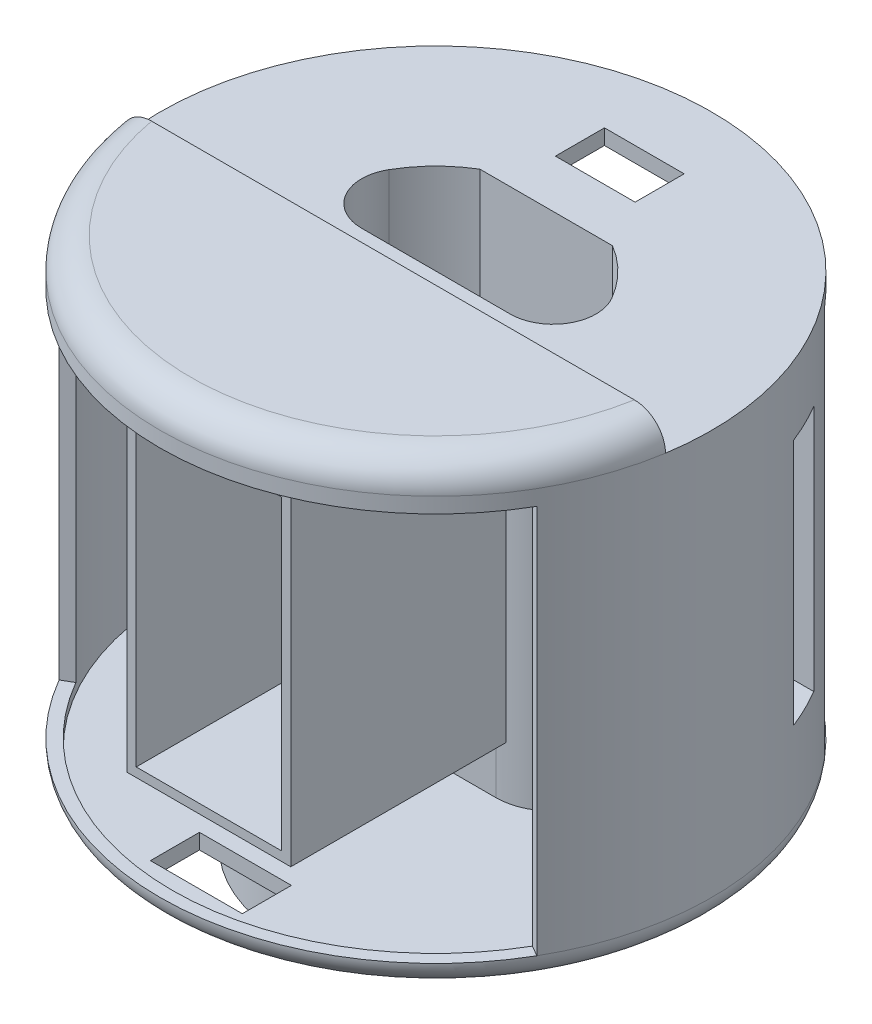
from build123d import *
from build123d.topology import SkipClean

# Parameters (mm, degrees)
CUT_EXTRUDE1_DEPTH           = 5
CUT_EXTRUDE3_DEPTH           = 70
SKETCH8_R                    = 43
CUT_EXTRUDE4_DEPTH           = 65
FILLET1_R                    = 7
SKETCH12_W                   = 6.5
SKETCH12_H                   = 63.5
CUT_REVOLVE1_ANGLE           = 60
CUT_REVOLVE1_OTHER_WAY_ANGLE = 60
SKETCH18_W                   = 13
SKETCH18_H                   = 8
CUT_EXTRUDE13_DEPTH          = 5
SKETCH20_W                   = 100
SKETCH20_H                   = 7
CUT_EXTRUDE15_DEPTH          = 5
SKETCH19_R                   = 1.5
CUT_EXTRUDE14_DEPTH          = 12
FILLET3_R                    = 4
SKETCH24_W                   = 2
SKETCH24_H                   = 3
BOSS_EXTRUDE3_DEPTH          = 2
CIRPATTERN2_COUNT            = 5
SKETCH26_W                   = 5
SKETCH26_H                   = 63.5
CUT_REVOLVE2_ANGLE           = 50
CUT_REVOLVE2_OTHER_WAY_ANGLE = 50
FILLET8_R                    = 9
SKETCH50_W                   = 13
SKETCH50_H                   = 5
CUT_EXTRUDE23_DEPTH          = 7
WRAP1_SECTION_W              = 14
WRAP1_SECTION_H              = 8
WRAP1_ANGLE                  = 29.893450181
SKETCH52_W                   = 21.079035893
SKETCH52_H                   = 8
BOSS_EXTRUDE11_DEPTH         = 7
BOSS_EXTRUDE12_START         = -1
SKETCH53_W                   = 3
SKETCH53_H                   = 7
BOSS_EXTRUDE12_DEPTH         = 3
SKETCH54_W                   = 1.6
SKETCH54_H                   = 7
BOSS_EXTRUDE13_DEPTH         = 16
SKETCH55_W                   = 4
SKETCH55_H                   = 7
BOSS_EXTRUDE14_DEPTH         = 6
SKETCH56_W                   = 3
SKETCH56_H                   = 7
CUT_EXTRUDE24_DEPTH          = 1
FILLET9_R                    = 2
SKETCH57_R                   = 1
CUT_EXTRUDE25_DEPTH          = 2
MIRROR6_START                = 14.3
MIRROR6_DEPTH                = 3.544129525
MIRROR6_START_2              = 19.844129625
MIRROR6_2_DEPTH              = 1.455870375
MIRROR6_START_3              = 17.844129525
MIRROR6_3_DEPTH              = 2.0000001
MIRROR6_START_4              = -10.618295229
MIRROR6_4_OUTLINE_R          = 1
MIRROR6_4_DEPTH              = 2
SKETCH61_W                   = 1.5
SKETCH61_H                   = 40.3
BOSS_EXTRUDE15_DEPTH         = 10
SKETCH63_W                   = 6.5
SKETCH63_H                   = 40.3
CUT_EXTRUDE27_DEPTH          = 10
CUT_EXTRUDE28_DEPTH          = 44
SKETCH67_W                   = 15
SKETCH67_H                   = 8
CUT_EXTRUDE29_DEPTH          = 5
SKETCH68_W                   = 23.715050839
SKETCH68_H                   = 50
CUT_EXTRUDE30_DEPTH          = 8
BOSS_EXTRUDE19_DEPTH         = 35
BOSS_EXTRUDE19_DEPTH_BACK    = 1
SKETCH69_W                   = 26.715050839
SKETCH69_H                   = 53
SKETCH69_W_2                 = 23.715050839
SKETCH69_H_2                 = 50


with BuildPart() as part:
    # Sketch1 → Revolve1 (revolve)
    with BuildSketch(Plane.XY, mode=Mode.PRIVATE) as revolve1_sk:
        with BuildLine():
            Line((0, 86.5), (0, 11.5))
            Line((0, 11.5), (22.7, 11.5))
            Line((22.7, 11.5), (22.7, 0))
            Line((22.7, 0), (25, 0))
            Line((25, 0), (25, 11.5))
            Line((25, 11.5), (45, 11.5))
            Line((45, 11.5), (45, 81.5))
            ThreePointArc((45, 81.5), (43.535533906, 85.035533906), (40, 86.5))
            Line((40, 86.5), (0, 86.5))
        make_face()
    revolve(revolve1_sk.sketch.rotate(Axis((0, 2, 0), (0, 1, 0)), 90), axis=Axis((0, 2, 0), (0, 1, 0)))

    # Sketch5 → Cut-Extrude1 (cut)
    with BuildSketch(Plane(origin=(0, 86.5, 0), x_dir=(1, 0, 0), z_dir=(0, 1, 0))):
        with BuildLine():
            Line((-45, 0), (45, 0))
            ThreePointArc((45, 0), (0, 45), (-45, 0))
        make_face()
    extrude(amount=-CUT_EXTRUDE1_DEPTH, mode=Mode.SUBTRACT)

    # Sketch7 → Cut-Extrude3 (cut)
    with BuildSketch(Plane.XZ.offset(-11.5)):
        with BuildLine():
            Line((21, 0), (-21, 0))
            ThreePointArc((-21, 0), (-18.277714988, -10.340461055), (-10.816653826, -18))
            Line((-10.816653826, -18), (10.816653826, -18))
            ThreePointArc((10.816653826, -18), (18.277714988, -10.340461055), (21, 0))
        make_face()
    extrude(amount=-CUT_EXTRUDE3_DEPTH, mode=Mode.SUBTRACT)

    # Sketch8 → Cut-Extrude4 (cut)
    with BuildSketch(Plane(origin=(0, 79, 0), x_dir=(1, 0, 0), z_dir=(0, 1, 0))):
        with Locations(Location((0, 0, 0), (0, 0, 270))):
            Circle(SKETCH8_R)
        with BuildLine():
            Line((22.912878475, -2), (-22.981606036, -2))
            ThreePointArc((-22.981606036, -2), (-20.067855169, 10.855581536), (-10.573881727, 20))
            Line((-10.573881727, 20), (10.505154166, 20))
            ThreePointArc((10.505154166, 20), (19.999127608, 10.855581536), (22.912878475, -2))
        make_face(mode=Mode.SUBTRACT)
    extrude(amount=-CUT_EXTRUDE4_DEPTH, mode=Mode.SUBTRACT)

    # Fillet1
    fillet1_edges = [part.edges().sort_by_distance(p)[0] for p in [
        (-21, 46.5, 0),
        (21, 46.5, 0),
    ]]
    fillet(fillet1_edges, radius=FILLET1_R)

    # Sketch12 → Cut-Revolve1 (revolve, cut)
    with BuildSketch(Plane(origin=(0, 0, 0), x_dir=(0, 0, -1), z_dir=(1, 0, 0))):
        with Locations((-44.75, 47.25)):
            Rectangle(SKETCH12_W, SKETCH12_H)
    revolve(axis=Axis((0, 81.5, 0), (0, -1, 0)), revolution_arc=CUT_REVOLVE1_ANGLE, mode=Mode.SUBTRACT)

    # Sketch12 → Cut-Revolve1 other way (revolve, cut)
    with BuildSketch(Plane(origin=(0, 0, 0), x_dir=(0, 0, -1), z_dir=(1, 0, 0))):
        with Locations((-44.75, 47.25)):
            Rectangle(SKETCH12_W, SKETCH12_H)
    revolve(axis=Axis((0, 81.5, 0), (0, 1, 0)), revolution_arc=CUT_REVOLVE1_OTHER_WAY_ANGLE, mode=Mode.SUBTRACT)

    # Sketch18 → Cut-Extrude13 (cut)
    with BuildSketch(Plane(origin=(0, 81.5, 0), x_dir=(1, 0, 0), z_dir=(0, 1, 0))):
        with Locations((0, 30)):
            Rectangle(SKETCH18_W, SKETCH18_H)
    extrude(amount=-CUT_EXTRUDE13_DEPTH, mode=Mode.SUBTRACT)

    # Sketch20 → Cut-Extrude15 (cut)
    with BuildSketch(Plane(origin=(0, 86.5, 0), x_dir=(1, 0, 0), z_dir=(0, 1, 0))):
        with Locations((0, -3.5)):
            Rectangle(SKETCH20_W, SKETCH20_H)
    extrude(amount=-CUT_EXTRUDE15_DEPTH, mode=Mode.SUBTRACT)

    # Sketch19 → Cut-Extrude14 (cut)
    with BuildSketch(Plane(origin=(0, 0, 7), x_dir=(-1, 0, 0), z_dir=(0, 0, -1))):
        with Locations((0, 84)):
            Circle(SKETCH19_R)
        with Locations((-30, 84)):
            Circle(SKETCH19_R)
        with Locations((29.452221542, 84)):
            Circle(SKETCH19_R)
    extrude(amount=-CUT_EXTRUDE14_DEPTH, mode=Mode.SUBTRACT)

    # Fillet3
    fillet3_edges = [part.edges().sort_by_distance(p)[0] for p in [
        (0, 11.5, 45),
    ]]
    fillet(fillet3_edges, radius=FILLET3_R - 0.0001)  # a hair under: the kernel refuses the full size

    # Sketch24 → Boss-Extrude3 (add)
    with BuildSketch(Plane.XZ):
        with Locations((0, -22.7)):
            Rectangle(SKETCH24_W, SKETCH24_H)
    boss_extrude3 = extrude(amount=-BOSS_EXTRUDE3_DEPTH)

    # CirPattern2: Boss-Extrude3 ×5 about axis
    cirpattern2_axis = Axis((0, 0, 0), (0, 1, 0))
    for i in range(1, CIRPATTERN2_COUNT):
        add(boss_extrude3.rotate(cirpattern2_axis, i * 360 / CIRPATTERN2_COUNT))

    # Sketch26 → Cut-Revolve2 (revolve, cut)
    with BuildSketch(Plane(origin=(0, 0, 0), x_dir=(0, 0, -1), z_dir=(1, 0, 0))):
        with Locations((45.056943441, 47.25)):
            Rectangle(SKETCH26_W, SKETCH26_H)
    revolve(axis=Axis((0, 2, 0), (0, -1, 0)), revolution_arc=CUT_REVOLVE2_ANGLE, mode=Mode.SUBTRACT)

    # Sketch26 → Cut-Revolve2 other way (revolve, cut)
    with BuildSketch(Plane(origin=(0, 0, 0), x_dir=(0, 0, -1), z_dir=(1, 0, 0))):
        with Locations((45.056943441, 47.25)):
            Rectangle(SKETCH26_W, SKETCH26_H)
    revolve(axis=Axis((0, 2, 0), (0, 1, 0)), revolution_arc=CUT_REVOLVE2_OTHER_WAY_ANGLE, mode=Mode.SUBTRACT)

    # Fillet8
    fillet8_edges = [part.edges().sort_by_distance(p)[0] for p in [
        (-22.981606036, 46.5, 2),
        (22.912878475, 46.5, 2),
    ]]
    fillet(fillet8_edges, radius=FILLET8_R)

    # Sketch50 → Cut-Extrude23 (cut)
    with BuildSketch(Plane(origin=(0, 14, 0), x_dir=(1, 0, 0), z_dir=(0, 1, 0))):
        with Locations((32, 0)):
            Rectangle(SKETCH50_W, SKETCH50_H)
        with Locations((-32, 0)):
            Rectangle(SKETCH50_W, SKETCH50_H)
    extrude(amount=-CUT_EXTRUDE23_DEPTH, mode=Mode.SUBTRACT)

    # Wrap1 section (on wrap section) → Wrap1 (revolve)
    with BuildSketch(Plane(origin=(-0.03436378, 79, 0.443056559), x_dir=(0.8417807911855657, 0, -0.5398195064936087), z_dir=(0.5398195064936087, 0, 0.8417807911855657))):
        with Locations((30, -61)):
            Rectangle(WRAP1_SECTION_W, WRAP1_SECTION_H)
    wrap1 = revolve(axis=Axis((-0.03436378, 79, 0.443056559), (0, 1, 0)), revolution_arc=WRAP1_ANGLE)

    # Mirror3: Wrap1 across plane
    add(wrap1.mirror(Plane(origin=(0, 0, 0), x_dir=(0, 0, 1), z_dir=(1, 0, 0))))

    # Sketch52 → Boss-Extrude11 (add)
    with BuildSketch(Plane(origin=(0, 0, -20), x_dir=(-1, 0, 0), z_dir=(0, 0, -1))):
        with Locations((0.03436378, 18)):
            Rectangle(SKETCH52_W, SKETCH52_H)
    extrude(amount=BOSS_EXTRUDE11_DEPTH)



with BuildPart() as body_2:
    # Sketch53 → Boss-Extrude12 (new body)
    with BuildSketch(Plane(origin=(20.823161639, 0, 0), x_dir=(0, 0, -1), z_dir=(1, 0, 0)).offset(BOSS_EXTRUDE12_START)):
        with Locations((9.818295229, 17.8)):
            Rectangle(SKETCH53_W, SKETCH53_H)
    extrude(amount=BOSS_EXTRUDE12_DEPTH)


with BuildPart() as part_1:
    add(part.part)

    add(body_2.part)  # Boss-Extrude13 merges body 2
    # Sketch54 → Boss-Extrude13 (add)
    with BuildSketch(Plane(origin=(22.823161639, 0, 0), x_dir=(0, 0, -1), z_dir=(1, 0, 0))):
        with Locations((9.818295229, 17.8)):
            Rectangle(SKETCH54_W, SKETCH54_H)
    extrude(amount=BOSS_EXTRUDE13_DEPTH)

    # Sketch55 → Boss-Extrude14 (add)
    with BuildSketch(Plane.XY.offset(-9.118295229)):
        with Locations((34.823161639, 17.8)):
            Rectangle(SKETCH55_W, SKETCH55_H)
    extrude(amount=BOSS_EXTRUDE14_DEPTH)

    # Sketch56 → Cut-Extrude24 (cut)
    with BuildSketch(Plane.XY.offset(-9.018295229)):
        with Locations((25.823161639, 17.8)):
            Rectangle(SKETCH56_W, SKETCH56_H)
    extrude(amount=-CUT_EXTRUDE24_DEPTH, mode=Mode.SUBTRACT)

    # Fillet9
    # the kernel refuses this fillet: 2 mm, written as the material it takes off along each edge
    with BuildSketch(Plane(origin=(27.323161639, 25.630127019, -9.018295229), x_dir=(0, 0, -1), z_dir=(0, -1, 0))) as fillet9_piece_1_section:
        with BuildLine():
            CenterArc((2, 1.732050808), FILLET9_R, 180, 60)
            Line((0, 1.732050808), (0, 0))
            Line((0, 0), (1, 0))
        make_face()
    fillet9_piece_1 = extrude(amount=15.660254038, mode=Mode.PRIVATE)
    fillet9_piece_1 = split(fillet9_piece_1, bisect_by=Plane(origin=(27.323161639, 14, -9.018295229), z_dir=(0, 1, 0)), keep=Keep.TOP, mode=Mode.PRIVATE)
    add(fillet9_piece_1, mode=Mode.SUBTRACT)

    # Sketch57 → Cut-Extrude25 (cut)
    with BuildSketch(Plane(origin=(0, 0, -10.618295229), x_dir=(-1, 0, 0), z_dir=(0, 0, -1))):
        with Locations(Location((-36.823161639, 18.844129625, 0), (0, 0, 90))):
            Circle(SKETCH57_R)
    extrude(amount=-CUT_EXTRUDE25_DEPTH, mode=Mode.SUBTRACT)

    # Mirror6: read off the stored shape, not the designer's step
    # Mirror6 outline → Mirror6 (add)
    with BuildSketch(Plane(origin=(0, 0, 0), x_dir=(1, 0, 0), z_dir=(0, 1, 0)).offset(MIRROR6_START)):
        with BuildLine():
            Line((-32.823161639, 9.018295229), (-29.055212446, 9.018295229))
            ThreePointArc((-29.055212446, 9.018295229), (-28.055212446, 9.286244421), (-27.323161639, 10.018295229))
            Line((-27.323161639, 10.018295229), (-24.323161639, 10.018295229))
            Line((-24.323161639, 10.018295229), (-24.323161639, 9.018295229))
            Line((-24.323161639, 9.018295229), (-22.823161639, 9.018295229))
            Line((-22.823161639, 9.018295229), (-22.823161639, 8.318295229))
            Line((-22.823161639, 8.318295229), (-20.794815555, 8.318295229))
            ThreePointArc((-20.794815555, 8.318295229), (-20.436002794, 9.828095276), (-19.823161639, 11.253812113))
            Line((-19.823161639, 11.253812113), (-19.823161639, 11.318295229))
            Line((-19.823161639, 11.318295229), (-22.823161639, 11.318295229))
            Line((-22.823161639, 11.318295229), (-22.823161639, 10.618295229))
            Line((-22.823161639, 10.618295229), (-38.823161639, 10.618295229))
            Line((-38.823161639, 10.618295229), (-38.823161639, 9.018295229))
            Line((-38.823161639, 9.018295229), (-36.823161639, 9.018295229))
            Line((-36.823161639, 9.018295229), (-36.823161639, 8.618295229))
            Line((-36.823161639, 8.618295229), (-36.823161639, 3.118295229))
            Line((-36.823161639, 3.118295229), (-32.823161639, 3.118295229))
            Line((-32.823161639, 3.118295229), (-32.823161639, 9.018295229))
        make_face()
    extrude(amount=MIRROR6_DEPTH)

    # Mirror6 2 outline → Mirror6 2 (add)
    with BuildSketch(Plane(origin=(0, 0, 0), x_dir=(1, 0, 0), z_dir=(0, 1, 0)).offset(MIRROR6_START_2)):
        with BuildLine():
            Line((-32.823161639, 9.018295229), (-29.055212446, 9.018295229))
            ThreePointArc((-29.055212446, 9.018295229), (-28.055212446, 9.286244421), (-27.323161639, 10.018295229))
            Line((-27.323161639, 10.018295229), (-24.323161639, 10.018295229))
            Line((-24.323161639, 10.018295229), (-24.323161639, 9.018295229))
            Line((-24.323161639, 9.018295229), (-22.823161639, 9.018295229))
            Line((-22.823161639, 9.018295229), (-22.823161639, 8.318295229))
            Line((-22.823161639, 8.318295229), (-20.794815555, 8.318295229))
            ThreePointArc((-20.794815555, 8.318295229), (-20.436002794, 9.828095276), (-19.823161639, 11.253812113))
            Line((-19.823161639, 11.253812113), (-19.823161639, 11.318295229))
            Line((-19.823161639, 11.318295229), (-22.823161639, 11.318295229))
            Line((-22.823161639, 11.318295229), (-22.823161639, 10.618295229))
            Line((-22.823161639, 10.618295229), (-38.823161639, 10.618295229))
            Line((-38.823161639, 10.618295229), (-38.823161639, 9.018295229))
            Line((-38.823161639, 9.018295229), (-36.823161639, 9.018295229))
            Line((-36.823161639, 9.018295229), (-36.823161639, 8.618295229))
            Line((-36.823161639, 8.618295229), (-36.823161639, 3.118295229))
            Line((-36.823161639, 3.118295229), (-32.823161639, 3.118295229))
            Line((-32.823161639, 3.118295229), (-32.823161639, 9.018295229))
        make_face()
    extrude(amount=MIRROR6_2_DEPTH)

    # Mirror6 3 outline → Mirror6 3 (add)
    with BuildSketch(Plane(origin=(0, 0, 0), x_dir=(1, 0, 0), z_dir=(0, 1, 0)).offset(MIRROR6_START_3)):
        with BuildLine():
            Line((-32.823161639, 9.018295229), (-29.055212446, 9.018295229))
            ThreePointArc((-29.055212446, 9.018295229), (-28.055212446, 9.286244421), (-27.323161639, 10.018295229))
            Line((-27.323161639, 10.018295229), (-24.323161639, 10.018295229))
            Line((-24.323161639, 10.018295229), (-24.323161639, 9.018295229))
            Line((-24.323161639, 9.018295229), (-22.823161639, 9.018295229))
            Line((-22.823161639, 9.018295229), (-22.823161639, 8.318295229))
            Line((-22.823161639, 8.318295229), (-20.794815555, 8.318295229))
            ThreePointArc((-20.794815555, 8.318295229), (-20.436002794, 9.828095276), (-19.823161639, 11.253812113))
            Line((-19.823161639, 11.253812113), (-19.823161639, 11.318295229))
            Line((-19.823161639, 11.318295229), (-22.823161639, 11.318295229))
            Line((-22.823161639, 11.318295229), (-22.823161639, 10.618295229))
            Line((-22.823161639, 10.618295229), (-38.823161639, 10.618295229))
            Line((-38.823161639, 10.618295229), (-38.823161639, 9.018295229))
            Line((-38.823161639, 9.018295229), (-36.823161639, 9.018295229))
            Line((-36.823161639, 9.018295229), (-36.823161639, 8.618295229))
            Line((-36.823161639, 8.618295229), (-36.823161639, 3.118295229))
            Line((-36.823161639, 3.118295229), (-32.823161639, 3.118295229))
            Line((-32.823161639, 3.118295229), (-32.823161639, 9.018295229))
        make_face()
    extrude(amount=MIRROR6_3_DEPTH)

    # Mirror6 4 outline → Mirror6 4 (cut)
    with BuildSketch(Plane.XY.offset(MIRROR6_START_4)):
        with Locations((-36.823161639, 18.844129625)):
            Circle(MIRROR6_4_OUTLINE_R)
    extrude(amount=MIRROR6_4_DEPTH, mode=Mode.SUBTRACT)

    # Sketch61 → Boss-Extrude15 (add)
    with BuildSketch(Plane(origin=(45, 0, 0), x_dir=(0, 0, -1), z_dir=(1, 0, 0))):
        with Locations((23.675442436, 50.15)):
            Rectangle(SKETCH61_W, SKETCH61_H)
        with Locations((15.675442436, 50.15)):
            Rectangle(SKETCH61_W, SKETCH61_H)
        Polygon((24.425442436, 30), (24.425442436, 28.5), (14.925442436, 28.5), (14.925442436, 30), (16.425442436, 30), (22.925442436, 30), align=None)
        Polygon((22.925442436, 70.3), (24.425442436, 70.3), (24.425442436, 71.8), (14.925442436, 71.8), (14.925442436, 70.3), (16.425442436, 70.3), align=None)
    extrude(amount=-BOSS_EXTRUDE15_DEPTH)

    # Sketch63 → Cut-Extrude27 (cut)
    with BuildSketch(Plane(origin=(45, 0, 0), x_dir=(0, 0, -1), z_dir=(1, 0, 0))):
        with Locations((19.675442436, 50.15)):
            Rectangle(SKETCH63_W, SKETCH63_H)
    extrude(amount=-CUT_EXTRUDE27_DEPTH, mode=Mode.SUBTRACT)

    # Sketch66 → Cut-Extrude28 (cut)
    with SkipClean():  # the faces are left unmerged after this step: merging them gives an invalid solid
        with BuildSketch(Plane(origin=(0, 71.8, 0), x_dir=(1, 0, 0), z_dir=(0, 1, 0))):
            with BuildLine():
                Line((42.452693296, 14.925442436), (45, 14.925442436))
                Line((45, 14.925442436), (45, 24.425442436))
                Line((45, 24.425442436), (37.794149836, 24.425442436))
                ThreePointArc((37.794149836, 24.425442436), (40.403606994, 19.812837804), (42.452693296, 14.925442436))
            make_face()
        extrude(amount=-CUT_EXTRUDE28_DEPTH, mode=Mode.SUBTRACT)

    # Sketch67 → Cut-Extrude29 (cut)
    with SkipClean():  # the faces are left unmerged after this step: merging them gives an invalid solid
        with BuildSketch(Plane.XZ.offset(-11.5)):
            with Locations((0, 35.077013509)):
                Rectangle(SKETCH67_W, SKETCH67_H)
        extrude(amount=-CUT_EXTRUDE29_DEPTH, mode=Mode.SUBTRACT)

    # Sketch68 → Cut-Extrude30 (cut)
    with SkipClean():  # the faces are left unmerged after this step: merging them gives an invalid solid
        with BuildSketch(Plane.XY.offset(2)):
            with Locations((-0.034363781, 49)):
                Rectangle(SKETCH68_W, SKETCH68_H)
        extrude(amount=-CUT_EXTRUDE30_DEPTH, mode=Mode.SUBTRACT)

    # Sketch69 → Boss-Extrude19 (add, two sides: drawn at the far end of the back side and taken through both)
    with SkipClean():  # the faces are left unmerged after this step: merging them gives an invalid solid
        with BuildSketch(Plane.XY.offset(2).offset(-BOSS_EXTRUDE19_DEPTH_BACK)):
            with Locations((-0.034363781, 49)):
                Rectangle(SKETCH69_W, SKETCH69_H)
            with Locations((-0.034363781, 49)):
                Rectangle(SKETCH69_W_2, SKETCH69_H_2, mode=Mode.SUBTRACT)
        extrude(amount=BOSS_EXTRUDE19_DEPTH + BOSS_EXTRUDE19_DEPTH_BACK)


solid = part_1.part
